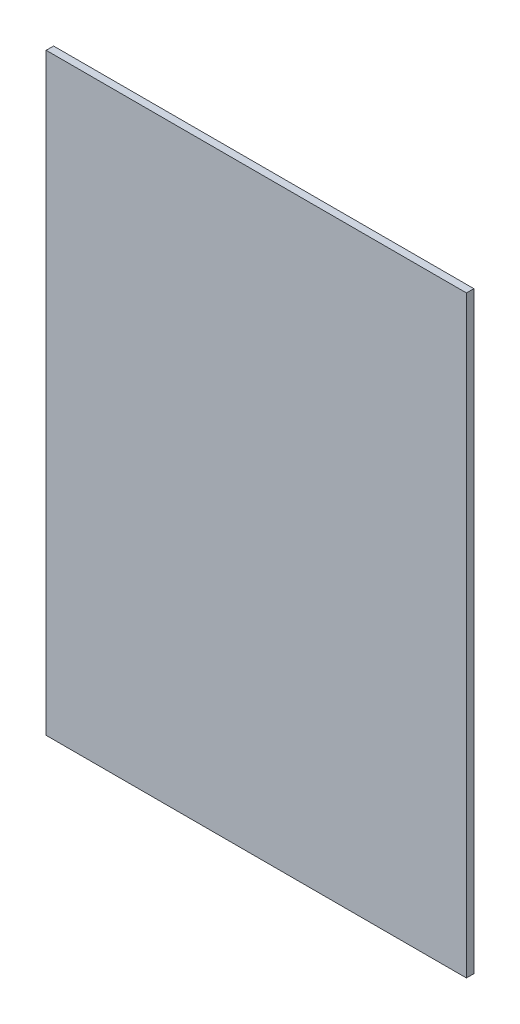
from build123d import *

# Parameters (mm, degrees)
ESQUISSE1_W        = 170
ESQUISSE1_H        = 240
BOSS_EXTRU_1_DEPTH = 3


with BuildPart() as part:
    # Esquisse1 → Boss.-Extru.1 (new body)
    with BuildSketch(Plane.XY):
        with Locations((19.349919944, -52.325761421)):
            Rectangle(ESQUISSE1_W, ESQUISSE1_H)
    extrude(amount=BOSS_EXTRU_1_DEPTH)


solid = part.part
